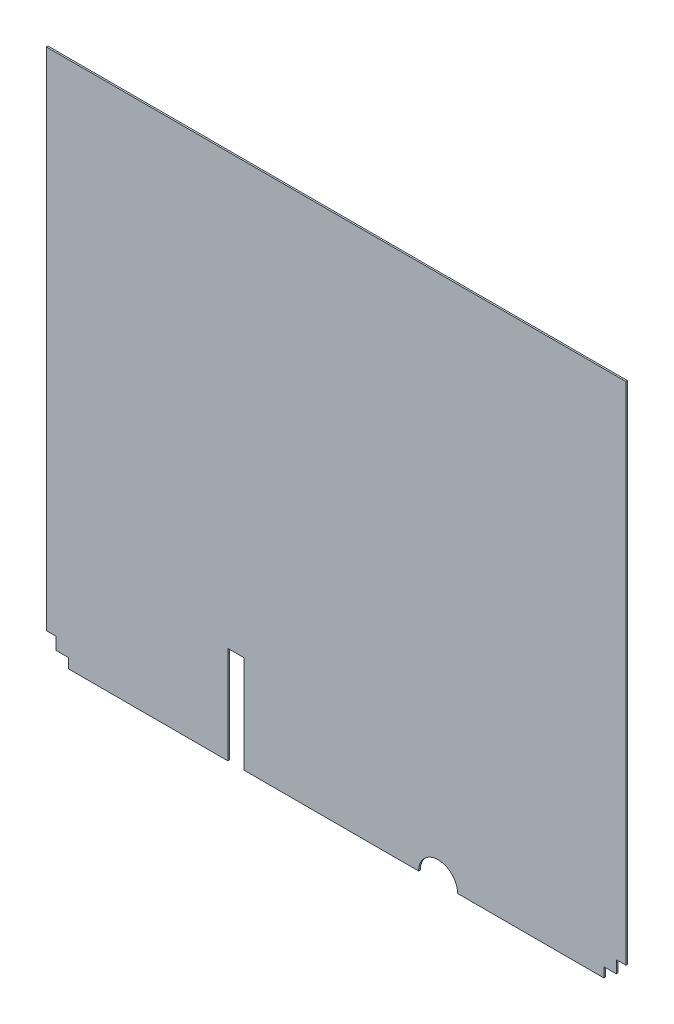
from build123d import *

# Parameters (mm, degrees)
BOSS_EXTRUDE1_DEPTH = 2.54


with BuildPart() as part:
    # Sketch1 → Boss-Extrude1 (new body)
    with BuildSketch(Plane.XY):
        with BuildLine():
            Line((0, 825.5), (0, 34.544))
            Line((0, 34.544), (15.24, 34.544))
            Line((15.24, 34.544), (15.24, 15.24))
            Line((15.24, 15.24), (34.544, 15.24))
            Line((34.544, 15.24), (34.544, 0))
            Line((34.544, 0), (283.837490085, 0))
            Line((283.837490085, 0), (283.837490085, 152.4))
            Line((283.837490085, 152.4), (309.237490085, 152.4))
            Line((309.237490085, 152.4), (309.237490085, 0))
            Line((309.237490085, 0), (582.538284777, 0))
            ThreePointArc((582.538284777, 0), (613.018284777, 30.48), (643.498284777, 0))
            Line((643.498284777, 0), (872.45698, 0))
            Line((872.45698, 0), (872.45698, 15.24))
            Line((872.45698, 15.24), (891.76098, 15.24))
            Line((891.76098, 15.24), (891.76098, 34.544))
            Line((891.76098, 34.544), (907.00098, 34.544))
            Line((907.00098, 34.544), (907.00098, 825.5))
            Line((907.00098, 825.5), (0, 825.5))
        make_face()
    extrude(amount=BOSS_EXTRUDE1_DEPTH)


solid = part.part
